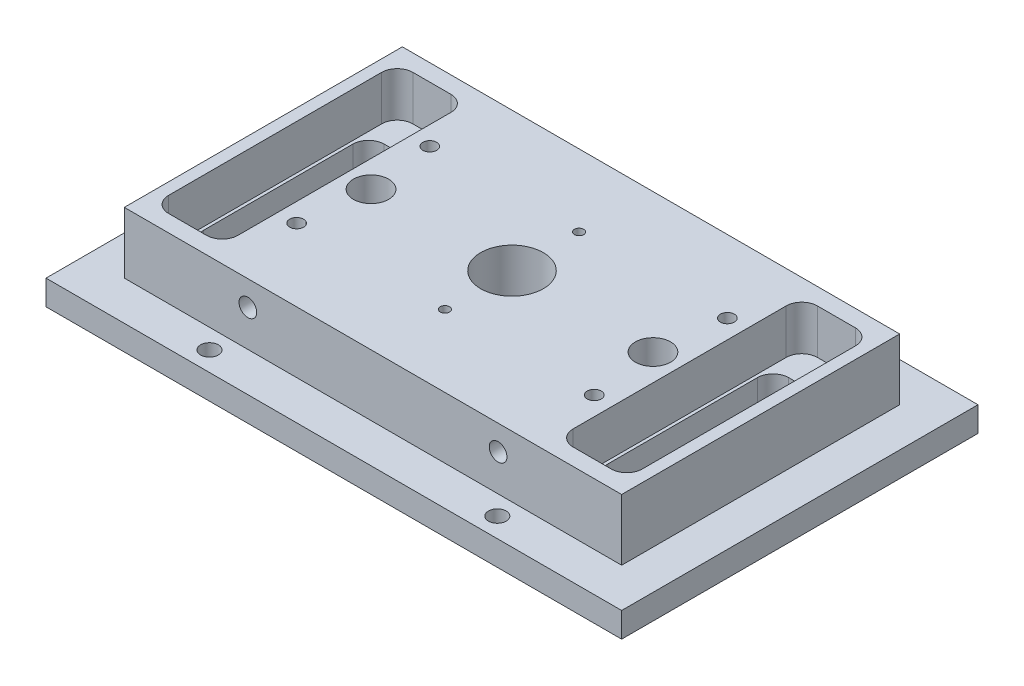
from build123d import *

# Parameters (mm, degrees)
MAIN_SKETCH_W                         = 73.5
MAIN_SKETCH_H                         = 45.5
MAIN_SKETCH_W_2                       = 8.85
MAIN_SKETCH_H_2                       = 31.2
MAIN_SKETCH_R                         = 2.2479
LIP_DEPTH                             = 3.175
MOUNTING_BASE_OUTLINE_W               = 63.5
MOUNTING_BASE_OUTLINE_H               = 35.5
MOUNTING_BASE_OUTLINE_R               = 2.2479
MOUNTING_BASE_OUTLINE_R_2             = 4
MOUNTING_BASE_DEPTH                   = 11
HEATER_CART_4_40_TAPS_D               = 2.2606
HEATER_CART_4_40_TAPS_DEPTH           = 8.255
HEATER_CART_4_40_TAPS_TIP             = 0.679152758
HEATER_CART_4_40_TAPS_ON_FACE_2_D     = 2.2606
HEATER_CART_4_40_TAPS_ON_FACE_2_DEPTH = 8.255
HEATER_CART_4_40_TAPS_ON_FACE_2_TIP   = 0.679152758
MAIN_SKETCH_12_W                      = 8.85
MAIN_SKETCH_12_H                      = 31.2
MAIN_SKETCH_12_R                      = 0.285
BOTTOM_SQUARE_CUTOUT_DEPTH            = 2
SQUARE_MICRO_D_CUTOUT_START           = 5.3
SQUARE_MICRO_D_CUTOUT_OUTLINE_W       = 8.85
SQUARE_MICRO_D_CUTOUT_OUTLINE_H       = 31.2
SQUARE_MICRO_D_CUTOUT_OUTLINE_R       = 0.285
SQUARE_MICRO_D_CUTOUT_DEPTH           = 5.7
SKETCH15_W                            = 8.067488146
SKETCH15_H                            = 23.070933647
CUT_EXTRUDE1_DEPTH                    = 11
INTERNAL_CORNER_CUTOUTS_FILLET_R      = 2
CHIP_CLAMP_0_80_TAPS_AT_2_COUNT       = 2
CHIP_CLAMP_0_80_TAPS_AT_2_PITCH       = 17.1232
CHIP_CLAMP_0_80_TAPS_AT_3_COUNT       = 2
CHIP_CLAMP_0_80_TAPS_AT_3_PITCH       = 17.1232
F_2_56_CLOSE_CLEAR_43_0_089_D         = 2.2606
PCB_2_56_TAPS_D                       = 1.778
PCB_2_56_TAPS_DEPTH                   = 5.734
PCB_2_56_TAPS_TIP                     = 0.53416509
BOTTOM_COVER_2_56_TAPS_D              = 1.778
BOTTOM_COVER_2_56_TAPS_DEPTH          = 5.734
BOTTOM_COVER_2_56_TAPS_TIP            = 0.53416509
F_2_56_TAPPED_HOLE1_D                 = 1.778
F_2_56_TAPPED_HOLE1_DEPTH             = 5.734
F_2_56_TAPPED_HOLE1_TIP               = 0.53416509


# Read off the part's stored shape, not the designer's step: Mounting_Base, Square_Micro_D_Cutout
with BuildPart() as part:
    # Main_Sketch → Lip (new body)
    with BuildSketch(Plane(origin=(0, 0, 0), x_dir=(1, 0, 0), z_dir=(0, 1, 0))):
        with Locations((36.75, -22.75)):
            Rectangle(MAIN_SKETCH_W, MAIN_SKETCH_H)
        with Locations((10.925, -22.749999985)):
            Rectangle(MAIN_SKETCH_W_2, MAIN_SKETCH_H_2, mode=Mode.SUBTRACT)
        with Locations(Location((18.75, -22.75, 0), (0, 0, 270))):
            Circle(MAIN_SKETCH_R, mode=Mode.SUBTRACT)
        with BuildLine():
            ThreePointArc((31.675, -20.175), (29.907233047, -15.907233047), (34.175, -17.675))
            Line((34.175, -17.675), (39.325, -17.675))
            ThreePointArc((39.325, -17.675), (43.592766953, -15.907233047), (41.825, -20.175))
            Line((41.825, -20.175), (41.825, -25.325))
            ThreePointArc((41.825, -25.325), (43.592766953, -29.592766953), (39.325, -27.825))
            Line((39.325, -27.825), (34.175, -27.825))
            ThreePointArc((34.175, -27.825), (29.907233047, -29.592766953), (31.675, -25.325))
            Line((31.675, -25.325), (31.675, -20.175))
        make_face(mode=Mode.SUBTRACT)
        with Locations(Location((54.75, -22.75, 0), (0, 0, 270))):
            Circle(MAIN_SKETCH_R, mode=Mode.SUBTRACT)
    extrude(amount=LIP_DEPTH)

    # Mounting_Base outline → Mounting_Base (add)
    with BuildSketch(Plane(origin=(0, 0, 0), x_dir=(1, 0, 0), z_dir=(0, 1, 0))):
        with Locations((36.75, -22.75)):
            Rectangle(MOUNTING_BASE_OUTLINE_W, MOUNTING_BASE_OUTLINE_H)
        with Locations((18.75, -22.75)):
            Circle(MOUNTING_BASE_OUTLINE_R, mode=Mode.SUBTRACT)
        with Locations((54.75, -22.75)):
            Circle(MOUNTING_BASE_OUTLINE_R, mode=Mode.SUBTRACT)
        with Locations((36.75, -22.75)):
            Circle(MOUNTING_BASE_OUTLINE_R_2, mode=Mode.SUBTRACT)
    extrude(amount=MOUNTING_BASE_DEPTH)

    # Heater_Cart_#4-40_Taps
    with Locations(Plane(origin=(52.725, 7.825, 5), x_dir=(-1, 0, 0), z_dir=(0, 0, -1))):
        with Locations((0, 0), (31.95, 0)):
            Hole(HEATER_CART_4_40_TAPS_D / 2, depth=HEATER_CART_4_40_TAPS_DEPTH)
            with Locations((0, 0, -(HEATER_CART_4_40_TAPS_DEPTH + HEATER_CART_4_40_TAPS_TIP / 2))):  # 118° drill point
                Cone(0, HEATER_CART_4_40_TAPS_D / 2, HEATER_CART_4_40_TAPS_TIP, mode=Mode.SUBTRACT)

    # Heater_Cart_#4-40_Taps on face 2
    with Locations(Plane(origin=(20.775, 7.825, 40.5), x_dir=(1, 0, 0), z_dir=(0, 0, 1))):
        with Locations((0, 0), (31.95, 0)):
            Hole(HEATER_CART_4_40_TAPS_ON_FACE_2_D / 2, depth=HEATER_CART_4_40_TAPS_ON_FACE_2_DEPTH)
            with Locations((0, 0, -(HEATER_CART_4_40_TAPS_ON_FACE_2_DEPTH + HEATER_CART_4_40_TAPS_ON_FACE_2_TIP / 2))):  # 118° drill point
                Cone(0, HEATER_CART_4_40_TAPS_ON_FACE_2_D / 2, HEATER_CART_4_40_TAPS_ON_FACE_2_TIP, mode=Mode.SUBTRACT)

    # Main_Sketch<12> → Bottom_square_cutout (cut)
    # profile 1 of 2: a face of its own
    with BuildSketch(Plane(origin=(0, 0, 0), x_dir=(1, 0, 0), z_dir=(0, 1, 0))):
        with Locations((10.925, -22.749999985)):
            Rectangle(MAIN_SKETCH_12_W, MAIN_SKETCH_12_H)
        with BuildLine():
            ThreePointArc((10.385689992, -35.285466808), (9.155254643, -35.471894814), (7.986136174, -35.045410869))
            ThreePointArc((7.986136174, -35.045410869), (7.18175843, -34.143309058), (6.891255927, -32.970099985))
            Line((6.891255927, -32.970099985), (6.891255927, -12.529899985))
            ThreePointArc((6.891255927, -12.529899985), (7.18175845, -11.356690961), (7.986136174, -10.454589189))
            ThreePointArc((7.986136174, -10.454589189), (9.155254643, -10.028105244), (10.385689992, -10.21453325))
            Line((10.385689992, -10.21453325), (13.424612074, -11.500982853))
            ThreePointArc((13.424612074, -11.500982853), (14.540409069, -12.427601581), (14.958744073, -13.816349588))
            Line((14.958744073, -13.816349588), (14.958744073, -31.683650456))
            ThreePointArc((14.958744073, -31.683650456), (14.540409073, -33.072398471), (13.424612074, -33.999017205))
            Line((13.424612074, -33.999017205), (10.385689992, -35.285466808))
        make_face(mode=Mode.SUBTRACT)
    # profile 2 of 2: a face of its own
    with BuildSketch(Plane(origin=(0, 0, 0), x_dir=(1, 0, 0), z_dir=(0, 1, 0))):
        with BuildLine():
            ThreePointArc((7.986136174, -35.045410869), (7.18175843, -34.143309058), (6.891255927, -32.970099985))
            Line((6.891255927, -32.970099985), (6.891255927, -12.529899985))
            ThreePointArc((6.891255927, -12.529899985), (7.18175845, -11.356690961), (7.986136174, -10.454589189))
            ThreePointArc((7.986136174, -10.454589189), (9.155254643, -10.028105244), (10.385689992, -10.21453325))
            Line((10.385689992, -10.21453325), (13.424612074, -11.500982853))
            ThreePointArc((13.424612074, -11.500982853), (14.540409069, -12.427601581), (14.958744073, -13.816349588))
            Line((14.958744073, -13.816349588), (14.958744073, -31.683650456))
            ThreePointArc((14.958744073, -31.683650456), (14.540409073, -33.072398471), (13.424612074, -33.999017205))
            Line((13.424612074, -33.999017205), (10.385689992, -35.285466808))
            ThreePointArc((10.385689992, -35.285466808), (9.155254643, -35.471894814), (7.986136174, -35.045410869))
        make_face()
        with Locations(Location((10.239255927, -22.75, 0), (0, 0, 270))):
            Circle(MAIN_SKETCH_12_R, mode=Mode.SUBTRACT)
    bottom_square_cutout = extrude(amount=BOTTOM_SQUARE_CUTOUT_DEPTH, mode=Mode.SUBTRACT)

    # Square_Micro_D_Cutout outline → Square_Micro_D_Cutout (cut)
    with BuildSketch(Plane(origin=(0, 0, 0), x_dir=(1, 0, 0), z_dir=(0, 1, 0)).offset(SQUARE_MICRO_D_CUTOUT_START)):
        with Locations((10.925, -22.749999985)):
            Rectangle(SQUARE_MICRO_D_CUTOUT_OUTLINE_W, SQUARE_MICRO_D_CUTOUT_OUTLINE_H)
        with Locations((10.239255927, -22.75)):
            Circle(SQUARE_MICRO_D_CUTOUT_OUTLINE_R, mode=Mode.SUBTRACT)
    square_micro_d_cutout = extrude(amount=SQUARE_MICRO_D_CUTOUT_DEPTH, mode=Mode.SUBTRACT)

    # Sketch15 → Cut-Extrude1 (cut)
    with BuildSketch(Plane(origin=(0, 0, 0), x_dir=(1, 0, 0), z_dir=(0, 1, 0))):
        with Locations((10.925, -22.749999985)):
            Rectangle(SKETCH15_W, SKETCH15_H)
    cut_extrude1 = extrude(amount=CUT_EXTRUDE1_DEPTH, mode=Mode.SUBTRACT)

    # MicroD_Mirror: Bottom_square_cutout, Square_Micro_D_Cutout, Cut-Extrude1 across plane
    add(bottom_square_cutout.mirror(Plane(origin=(36.75, 0, 0), x_dir=(0, 0, 1), z_dir=(1, 0, 0))), mode=Mode.SUBTRACT)
    add(square_micro_d_cutout.mirror(Plane(origin=(36.75, 0, 0), x_dir=(0, 0, 1), z_dir=(1, 0, 0))), mode=Mode.SUBTRACT)
    add(cut_extrude1.mirror(Plane(origin=(36.75, 0, 0), x_dir=(0, 0, 1), z_dir=(1, 0, 0))), mode=Mode.SUBTRACT)

    # Internal_Corner_cutouts_fillet
    internal_corner_cutouts_fillet_edges = [part.edges().sort_by_distance(p)[0] for p in [
        (15.35, 1, 38.349999985),
        (15.35, 1, 7.149999985),
        (6.5, 1, 7.149999985),
        (6.5, 1, 38.349999985),
        (15.35, 8.15, 38.349999985),
        (6.5, 8.15, 38.349999985),
        (6.5, 8.15, 7.149999985),
        (15.35, 8.15, 7.149999985),
        (14.958744073, 3.65, 34.285466808),
        (14.958744073, 3.65, 11.214533161),
        (6.891255927, 3.65, 11.214533161),
        (6.891255927, 3.65, 34.285466808),
        (58.15, 1, 7.149999985),
        (58.15, 1, 38.349999985),
        (67, 1, 38.349999985),
        (67, 1, 7.149999985),
        (67, 8.15, 7.149999985),
        (67, 8.15, 38.349999985),
        (58.15, 8.15, 38.349999985),
        (58.15, 8.15, 7.149999985),
        (58.541255927, 3.65, 11.214533161),
        (58.541255927, 3.65, 34.285466808),
        (66.608744073, 3.65, 34.285466808),
        (66.608744073, 3.65, 11.214533161),
    ]]
    fillet(internal_corner_cutouts_fillet_edges, radius=INTERNAL_CORNER_CUTOUTS_FILLET_R)

    # Sketch3 → Chip_Clamp_#0-80 Taps (revolve, cut)
    with BuildSketch(Plane(origin=(36.75, 11, 31.3116), x_dir=(0, 0, 1), z_dir=(1, 0, 0))):
        Polygon((0, 0), (0, 4.358890611), (0.59563, 4.001), (0.59563, 0), align=None)
    chip_clamp_0_80_taps = revolve(axis=Axis((36.75, 17.35, 31.3116), (0, -1, 0)), mode=Mode.SUBTRACT)

    # Chip_Clamp_#0-80 Taps at 2: Chip_Clamp_#0-80 Taps ×2
    with Locations(*[(0, 0, -i * CHIP_CLAMP_0_80_TAPS_AT_2_PITCH) for i in range(1, CHIP_CLAMP_0_80_TAPS_AT_2_COUNT)]):
        add(chip_clamp_0_80_taps, mode=Mode.SUBTRACT)

    # Chip_Clamp_#0-80 Taps at 3: Chip_Clamp_#0-80 Taps ×2
    with Locations(*[(0, 0, -i * CHIP_CLAMP_0_80_TAPS_AT_3_PITCH) for i in range(1, CHIP_CLAMP_0_80_TAPS_AT_3_COUNT)]):
        add(chip_clamp_0_80_taps, mode=Mode.SUBTRACT)

    # 2-56_Close_Clear#43 (0.089) (through all)
    with Locations(Plane(origin=(18.375, 0, 43), x_dir=(0, 0, -1), z_dir=(0, -1, 0))):
        with Locations((0, 0), (40.5, 0), (40.5, 36.75), (0, 36.75)):
            Hole(F_2_56_CLOSE_CLEAR_43_0_089_D / 2)

    # PCB #2-56 Taps
    with Locations(Plane(origin=(17.75, 11, 14.25), x_dir=(0, 0, 1), z_dir=(0, 1, 0))):
        with Locations((0, 0), (17, 0), (0, 38), (17, 38)):
            Hole(PCB_2_56_TAPS_D / 2, depth=PCB_2_56_TAPS_DEPTH)
            with Locations((0, 0, -(PCB_2_56_TAPS_DEPTH + PCB_2_56_TAPS_TIP / 2))):  # 118° drill point
                Cone(0, PCB_2_56_TAPS_D / 2, PCB_2_56_TAPS_TIP, mode=Mode.SUBTRACT)

    # Bottom_Cover#2-56 Taps
    with Locations(Plane(origin=(54.75, 0, 18.75), x_dir=(0, 0, -1), z_dir=(0, -1, 0))):
        with Locations((0, 0), (-8, 0), (-8, -36), (0, -36)):
            Hole(BOTTOM_COVER_2_56_TAPS_D / 2, depth=BOTTOM_COVER_2_56_TAPS_DEPTH)
            with Locations((0, 0, -(BOTTOM_COVER_2_56_TAPS_DEPTH + BOTTOM_COVER_2_56_TAPS_TIP / 2))):  # 118° drill point
                Cone(0, BOTTOM_COVER_2_56_TAPS_D / 2, BOTTOM_COVER_2_56_TAPS_TIP, mode=Mode.SUBTRACT)

    # #2-56 Tapped Hole1
    with Locations(Plane(origin=(32.94, 0, 31.38), x_dir=(0, 0, -1), z_dir=(0, -1, 0))):
        with Locations((0, 0), (-7.62, 0), (-7.62, 7.62), (0, 7.62)):
            Hole(F_2_56_TAPPED_HOLE1_D / 2, depth=F_2_56_TAPPED_HOLE1_DEPTH)
            with Locations((0, 0, -(F_2_56_TAPPED_HOLE1_DEPTH + F_2_56_TAPPED_HOLE1_TIP / 2))):  # 118° drill point
                Cone(0, F_2_56_TAPPED_HOLE1_D / 2, F_2_56_TAPPED_HOLE1_TIP, mode=Mode.SUBTRACT)


solid = part.part
